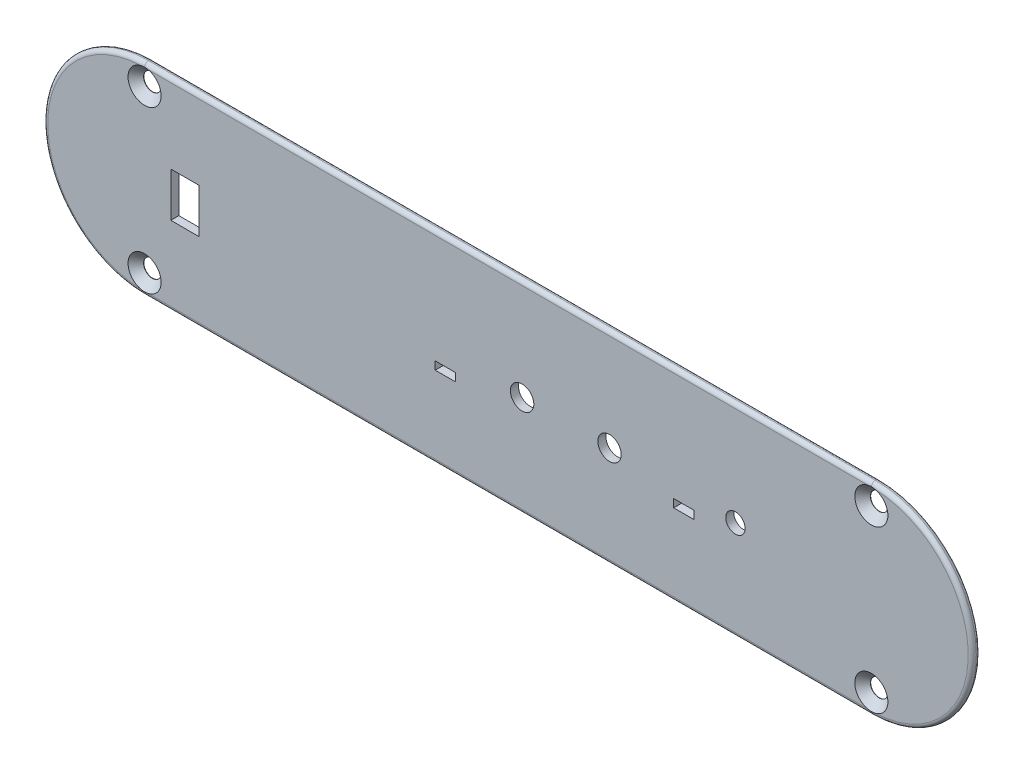
from build123d import *

# Parameters (mm, degrees)
BOSS_EXTRUDE1_DEPTH  = 2.54
SKETCH2_W            = 8.89
SKETCH2_H            = 13.97
CUT_EXTRUDE1_DEPTH   = 7.62
SKETCH3_R            = 3.683
CUT_EXTRUDE2_DEPTH   = 7.62
LPATTERN1_COUNT      = 2
LPATTERN1_PITCH      = 27.5
SKETCH4_R            = 3.048
CUT_EXTRUDE3_DEPTH   = 7.62
SKETCH6_W            = 6.35
SKETCH6_H            = 2.54
CUT_EXTRUDE5_DEPTH   = 2.54
FILLET1_R            = 1.27
LPATTERN4_COUNT      = 2
LPATTERN4_PITCH      = 228.6
LPATTERN4_COUNT_DIR2 = 2
LPATTERN4_PITCH_DIR2 = 50.8
LPATTERN5_COUNT      = 2
LPATTERN5_PITCH      = 75


with BuildPart() as part:
    # Sketch1 → Boss-Extrude1 (new body)
    with BuildSketch(Plane.XY):
        with BuildLine():
            Line((114.3, -31.75), (-114.3, -31.75))
            ThreePointArc((-114.3, -31.75), (-146.05, 0), (-114.3, 31.75))
            Line((-114.3, 31.75), (114.3, 31.75))
            ThreePointArc((114.3, 31.75), (146.05, 0), (114.3, -31.75))
        make_face()
    extrude(amount=BOSS_EXTRUDE1_DEPTH)

    # Sketch2 → Cut-Extrude1 (cut)
    with BuildSketch(Plane.XY.offset(2.54)):
        with Locations((-101.6, 0)):
            Rectangle(SKETCH2_W, SKETCH2_H)
    extrude(amount=-CUT_EXTRUDE1_DEPTH, mode=Mode.SUBTRACT)

    # Sketch3 → Cut-Extrude2 (cut)
    with BuildSketch(Plane.XY.offset(2.54)):
        with Locations((4.445, 0)):
            Circle(SKETCH3_R)
    cut_extrude2 = extrude(amount=-CUT_EXTRUDE2_DEPTH, mode=Mode.SUBTRACT)

    # LPattern1: Cut-Extrude2 ×2
    with Locations(*[(i * LPATTERN1_PITCH, 0, 0) for i in range(1, LPATTERN1_COUNT)]):
        add(cut_extrude2, mode=Mode.SUBTRACT)

    # Sketch4 → Cut-Extrude3 (cut)
    with BuildSketch(Plane.XY.offset(2.54)):
        with Locations((71.545, -0.635)):
            Circle(SKETCH4_R)
    extrude(amount=-CUT_EXTRUDE3_DEPTH, mode=Mode.SUBTRACT)

    # Sketch6 → Cut-Extrude5 (cut)
    with BuildSketch(Plane.XY.offset(2.54)):
        with Locations((55.289, -4.953)):
            Rectangle(SKETCH6_W, SKETCH6_H)
    cut_extrude5 = extrude(amount=-CUT_EXTRUDE5_DEPTH, mode=Mode.SUBTRACT)

    # Fillet1
    fillet1_edges = [part.edges().sort_by_distance(p)[0] for p in [
        (0, -31.75, 2.54),
        (-146.05, 0, 2.54),
        (0, 31.75, 2.54),
        (146.05, 0, 2.54),
        (146.05, 0, 0),
        (0, -31.75, 0),
        (-146.05, 0, 0),
        (0, 31.75, 0),
    ]]
    fillet(fillet1_edges, radius=FILLET1_R - 0.0001)  # a hair under: the kernel refuses the full size

    # Sketch9 → CSK for M5 Flat Head Machine Screw2 (revolve, cut)
    with BuildSketch(Plane(origin=(-114.3, 25.4, 2.54), x_dir=(0, -1, 0), z_dir=(1, 0, 0))):
        Polygon((0, 0), (0, 2.54), (2.75, 2.54), (2.75, 2.45), (5.2, 0), align=None)
    csk_for_m5_flat_head_machine_screw2 = revolve(axis=Axis((-114.3, 25.4, 8.89), (0, 0, -1)), mode=Mode.SUBTRACT)

    # LPattern4: CSK for M5 Flat Head Machine Screw2 2 × 2
    with Locations(*[(i * LPATTERN4_PITCH, -j * LPATTERN4_PITCH_DIR2, 0) for i in range(LPATTERN4_COUNT) for j in range(LPATTERN4_COUNT_DIR2) if (i, j) != (0, 0)]):
        add(csk_for_m5_flat_head_machine_screw2, mode=Mode.SUBTRACT)

    # LPattern5: Cut-Extrude5 ×2
    with Locations(*[(-i * LPATTERN5_PITCH, 0, 0) for i in range(1, LPATTERN5_COUNT)]):
        add(cut_extrude5, mode=Mode.SUBTRACT)


solid = part.part
